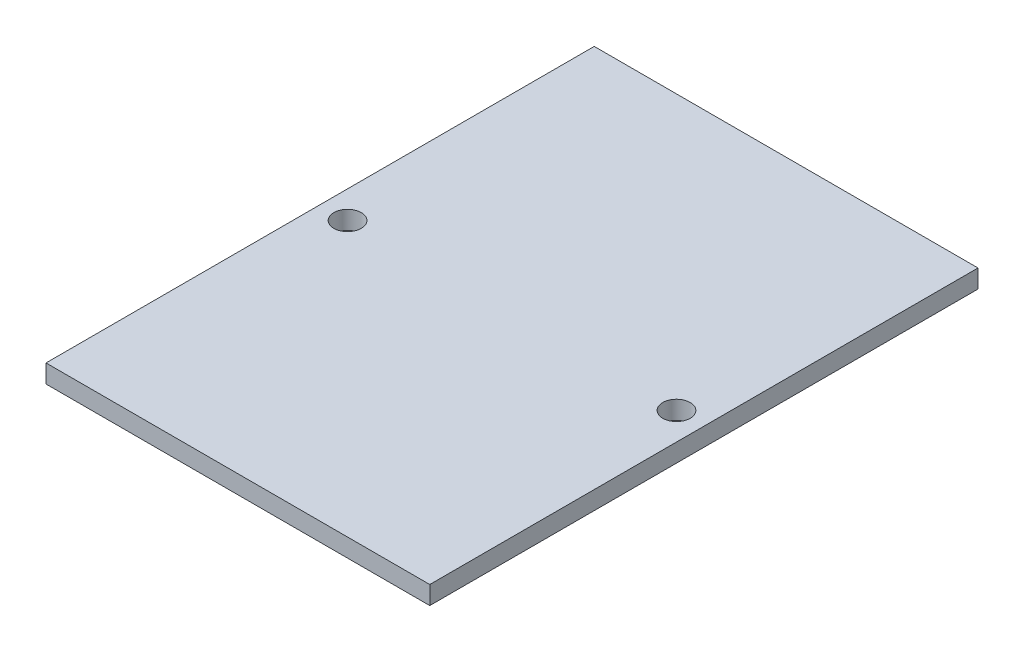
from build123d import *

# Parameters (mm, degrees)
SKETCH1_W           = 42
SKETCH1_H           = 60
SKETCH1_R           = 1.5
BOSS_EXTRUDE1_DEPTH = 2


with BuildPart() as part:
    # Sketch1 → Boss-Extrude1 (new body)
    with BuildSketch(Plane(origin=(0, 0, 0), x_dir=(1, 0, 0), z_dir=(0, 1, 0))):
        Rectangle(SKETCH1_W, SKETCH1_H)
        with Locations((18, 0)):
            Circle(SKETCH1_R, mode=Mode.SUBTRACT)
        with Locations((-18, 0)):
            Circle(SKETCH1_R, mode=Mode.SUBTRACT)
    extrude(amount=BOSS_EXTRUDE1_DEPTH)


solid = part.part
